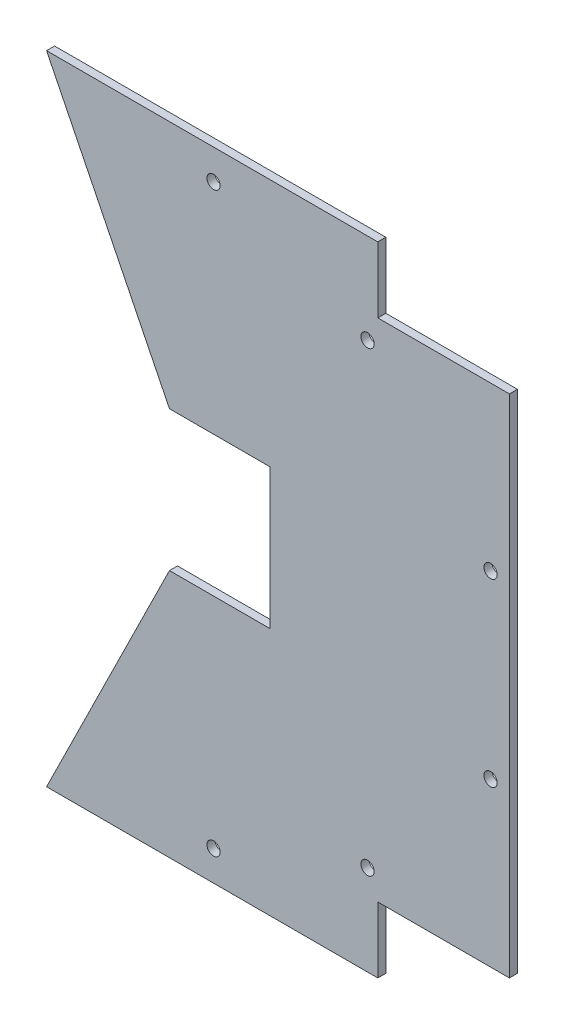
from build123d import *

# Parameters (mm, degrees)
SKETCH2_R           = 2.0955
BOSS_EXTRUDE1_DEPTH = 2.54


with BuildPart() as part:
    # Sketch2 → Boss-Extrude1 (new body)
    with BuildSketch(Plane(origin=(0, 0, 0), x_dir=(-1, 0, 0), z_dir=(0, 0, 1))):
        Polygon((-2.930050059, 168.708281075), (38.709428475, 168.708281075), (38.709428475, 189.536281075), (143.497061781, 189.536281075), (104.617436481, 110.859781075), (72.867436481, 110.859781075), (72.867436481, 66.536781075), (104.617436481, 66.536781075), (143.497061781, -12.139718925), (38.709428475, -12.139718925), (38.709428475, 8.688281075), (-2.930050059, 8.688281075), align=None)
        with Locations((41.95655448, 160.961281075)):
            Circle(SKETCH2_R, mode=Mode.SUBTRACT)
        with Locations((90.673911143, 180.011281075)):
            Circle(SKETCH2_R, mode=Mode.SUBTRACT)
        with Locations((90.673911143, -2.614718925)):
            Circle(SKETCH2_R, mode=Mode.SUBTRACT)
        with Locations((3.035061781, 117.209781075)):
            Circle(SKETCH2_R, mode=Mode.SUBTRACT)
        with Locations((3.035061781, 60.186781075)):
            Circle(SKETCH2_R, mode=Mode.SUBTRACT)
        with Locations((41.95655448, 16.435281075)):
            Circle(SKETCH2_R, mode=Mode.SUBTRACT)
    extrude(amount=BOSS_EXTRUDE1_DEPTH)


solid = part.part
